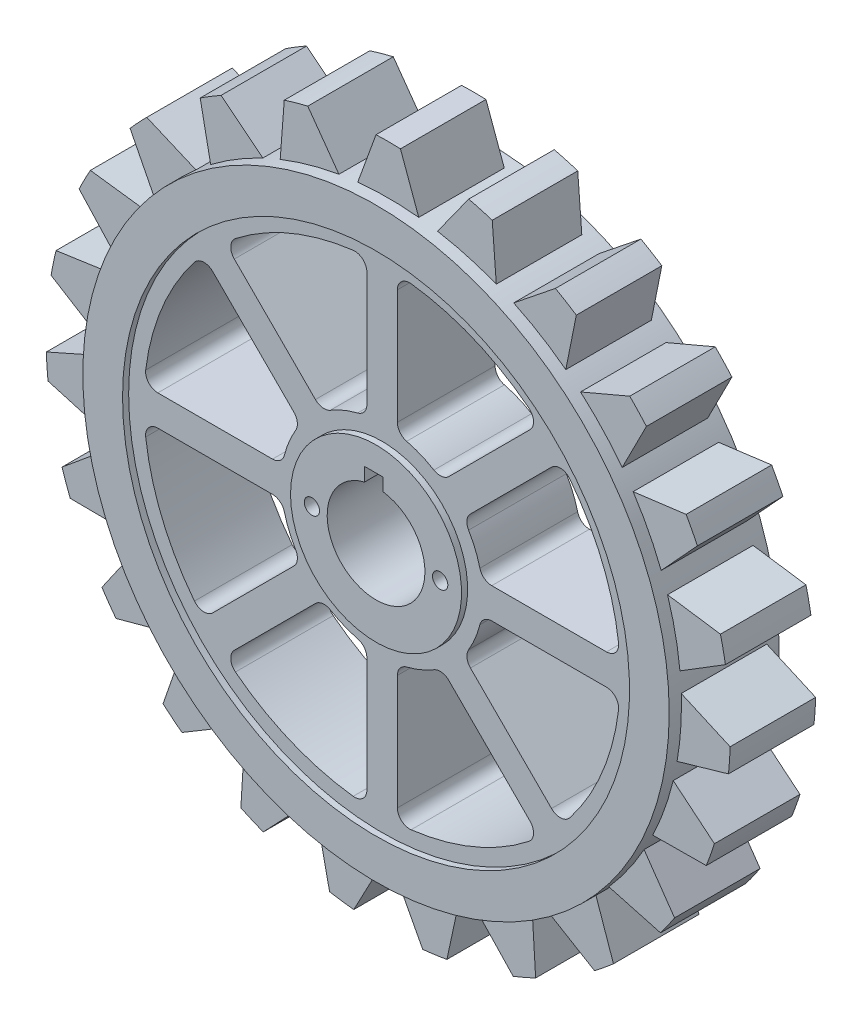
from build123d import *

# Parameters (mm, degrees)
SKETCH2_R                = 48
BOSS_EXTRUDE1_DEPTH      = 9
CUT_EXTRUDE1_DEPTH       = 71.228199464
SKETCH7_R                = 41.5
SKETCH7_R_2              = 14
CUT_EXTRUDE3_DEPTH       = 1
CUT_EXTRUDE4_DEPTH       = 70.978568148
FILLET1_R                = 2
CIRPATTERN2_COUNT        = 8
FILLET1_OF_CIRPATTERN2_R = 2
BOSS_EXTRUDE2_DEPTH      = 7
CIRPATTERN3_COUNT        = 23
CUT_EXTRUDE5_DEPTH       = 80.684840183
CUT_EXTRUDE5_DEPTH_BACK  = 80.684840183
SKETCH10_R               = 1.25


with BuildPart() as part:
    # Sketch2 → Boss-Extrude1 (new, symmetric)
    with BuildSketch(Plane.XY):
        Circle(SKETCH2_R)
    extrude(amount=BOSS_EXTRUDE1_DEPTH, both=True)

    # Sketch3 → Cut-Extrude1 (cut, through all)
    with BuildSketch(Plane.XY.offset(9)):
        with BuildLine():
            Line((-1.882722694, 10), (-1.882722694, 7.775304191))
            ThreePointArc((-1.882722694, 7.775304191), (0.389649871, -7.990505177), (1.117277306, 7.92159652))
            Line((1.117277306, 7.92159652), (1.117277306, 10))
            Line((1.117277306, 10), (-1.882722694, 10))
        make_face()
    extrude(amount=-CUT_EXTRUDE1_DEPTH, mode=Mode.SUBTRACT)

    # Sketch7 → Cut-Extrude3 (cut)
    with BuildSketch(Plane(origin=(0, 0, -9), x_dir=(-1, 0, 0), z_dir=(0, 0, -1))):
        Circle(SKETCH7_R)
        Circle(SKETCH7_R_2, mode=Mode.SUBTRACT)
    cut_extrude3 = extrude(amount=-CUT_EXTRUDE3_DEPTH, mode=Mode.SUBTRACT)

    # Mirror2: Cut-Extrude3 across plane
    add(cut_extrude3.mirror(Plane.XY), mode=Mode.SUBTRACT)

    # Sketch8 → Cut-Extrude4 (cut, through all)
    with BuildSketch(Plane(origin=(0, 0, -8), x_dir=(-1, 0, 0), z_dir=(0, 0, -1))):
        with BuildLine():
            ThreePointArc((25.752679991, 29.288213897), (14.924653862, 36.031301768), (2.5, 38.919789311))
            Line((2.5, 38.919789311), (2.5, 16.30950643))
            ThreePointArc((2.5, 16.30950643), (6.314276634, 15.244012286), (9.764795642, 13.300329548))
            Line((9.764795642, 13.300329548), (25.752679991, 29.288213897))
        make_face()
    cut_extrude4 = extrude(amount=-CUT_EXTRUDE4_DEPTH, mode=Mode.SUBTRACT)

    # Fillet1
    fillet1_edges = [part.edges().sort_by_distance(p)[0] for p in [
        (-2.5, 38.919789311, 0),
        (-25.752679991, 29.288213897, 0),
        (-9.764795642, 13.300329548, 0),
        (-2.5, 16.30950643, 0),
    ]]
    fillet(fillet1_edges, radius=FILLET1_R)

    # CirPattern2: Cut-Extrude4 ×8 about axis
    cirpattern2_axis = Axis((0, 0, -9), (0, 0, 1))
    for i in range(1, CIRPATTERN2_COUNT):
        add(cut_extrude4.rotate(cirpattern2_axis, i * 360 / CIRPATTERN2_COUNT), mode=Mode.SUBTRACT)

    # Fillet1 of CirPattern2
    fillet1_of_cirpattern2_edges = [part.edges().sort_by_distance(p)[0] for p in [
        (-29.288213897, 25.752679991, 0),
        (-38.919789311, 2.5, 0),
        (-16.30950643, 2.5, 0),
        (-13.300329548, 9.764795642, 0),
        (-38.919789311, -2.5, 0),
        (-29.288213897, -25.752679991, 0),
        (-13.300329548, -9.764795642, 0),
        (-16.30950643, -2.5, 0),
        (-25.752679991, -29.288213897, 0),
        (-2.5, -38.919789311, 0),
        (-2.5, -16.30950643, 0),
        (-9.764795642, -13.300329548, 0),
        (2.5, -38.919789311, 0),
        (25.752679991, -29.288213897, 0),
        (9.764795642, -13.300329548, 0),
        (2.5, -16.30950643, 0),
        (29.288213897, -25.752679991, 0),
        (38.919789311, -2.5, 0),
        (16.30950643, -2.5, 0),
        (13.300329548, -9.764795642, 0),
        (38.919789311, 2.5, 0),
        (29.288213897, 25.752679991, 0),
        (13.300329548, 9.764795642, 0),
        (16.30950643, 2.5, 0),
        (25.752679991, 29.288213897, 0),
        (2.5, 38.919789311, 0),
        (2.5, 16.30950643, 0),
        (9.764795642, 13.300329548, 0),
    ]]
    fillet(fillet1_of_cirpattern2_edges, radius=FILLET1_OF_CIRPATTERN2_R)

    # Sketch9 → Boss-Extrude2 (add, symmetric)
    with BuildSketch(Plane.XY):
        with BuildLine():
            Line((-2, 55.964274319), (-4.993555725, 47.73954756))
            ThreePointArc((-4.993555725, 47.73954756), (0, 48), (4.993555725, 47.73954756))
            Line((4.993555725, 47.73954756), (2, 55.964274319))
            ThreePointArc((2, 55.964274319), (0, 56), (-2, 55.964274319))
        make_face()
    boss_extrude2 = extrude(amount=BOSS_EXTRUDE2_DEPTH, both=True)

    # CirPattern3: Boss-Extrude2 ×23 about axis
    cirpattern3_axis = Axis((0, 0, -9), (0, 0, 1))
    for i in range(1, CIRPATTERN3_COUNT):
        add(boss_extrude2.rotate(cirpattern3_axis, i * 360 / CIRPATTERN3_COUNT))

    # Sketch10 → Cut-Extrude5 (cut, two sides: drawn at the far end of the back side and taken through both)
    with BuildSketch(Plane.XY.offset(-CUT_EXTRUDE5_DEPTH_BACK)):
        with Locations((-10.5, 0)):
            Circle(SKETCH10_R)
        with Locations((10.5, 0)):
            Circle(SKETCH10_R)
    extrude(amount=CUT_EXTRUDE5_DEPTH + CUT_EXTRUDE5_DEPTH_BACK, mode=Mode.SUBTRACT)


solid = part.part
